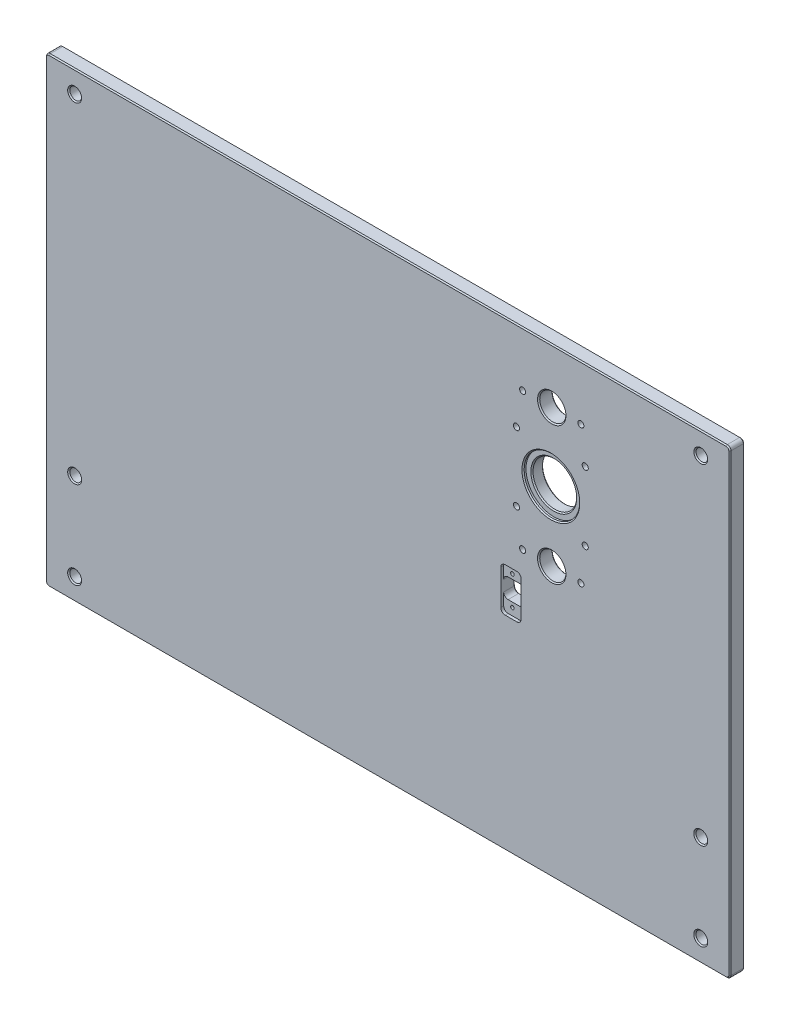
from build123d import *

# Parameters (mm, degrees)
SKETCH2_W             = 470
SKETCH2_H             = 317
BOSS_EXTRUDE1_DEPTH   = 5
SKETCH3_R             = 4.05
CUT_EXTRUDE1_DEPTH    = 10
SKETCH4_R             = 9
CUT_EXTRUDE2_DEPTH    = 284.632244288
M5X0_8_TAPPED_HOLE1_D = 4.2
SKETCH7_R             = 19.1
CUT_EXTRUDE5_DEPTH    = 2
M5X0_8_TAPPED_HOLE2_D = 4.2
SKETCH10_R            = 4
CUT_EXTRUDE8_DEPTH    = 284.632244288
SKETCH19_R            = 15
CUT_EXTRUDE10_DEPTH   = 284.568774727
SKETCH20_W            = 14
SKETCH20_H            = 30
CUT_EXTRUDE11_DEPTH   = 2
M3X0_5_TAPPED_HOLE2_D = 2.5
SKETCH23_W            = 14
SKETCH23_H            = 13.5
CUT_EXTRUDE13_DEPTH   = 284.568774727
FILLET1_R             = 3
FILLET2_R             = 2.5
CHAMFER1_SIZE         = 0.75


with BuildPart() as part:
    # Sketch2 → Boss-Extrude1 (new, symmetric)
    with BuildSketch(Plane.XY):
        Rectangle(SKETCH2_W, SKETCH2_H)
    extrude(amount=BOSS_EXTRUDE1_DEPTH, both=True)

    # Sketch3 → Cut-Extrude1 (cut)
    with BuildSketch(Plane.XY.offset(5)):
        with Locations((-215, -83.5)):
            Circle(SKETCH3_R)
        with Locations((-215, -143.5)):
            Circle(SKETCH3_R)
        with Locations((215, -83.5)):
            Circle(SKETCH3_R)
        with Locations((215, -143.5)):
            Circle(SKETCH3_R)
        with Locations((-215, 143.5)):
            Circle(SKETCH3_R)
    extrude(amount=-CUT_EXTRUDE1_DEPTH, mode=Mode.SUBTRACT)

    # Sketch4 → Cut-Extrude2 (cut, through all)
    with BuildSketch(Plane.XY.offset(5)):
        with Locations((112.65, 121)):
            Circle(SKETCH4_R)
        with Locations((112.65, 26.5)):
            Circle(SKETCH4_R)
    extrude(amount=-CUT_EXTRUDE2_DEPTH, mode=Mode.SUBTRACT)

    # M5x0.8 Tapped Hole1 (through all)
    with Locations(Plane.XY.offset(5)):
        with Locations((132.65, 121), (92.65, 121), (92.65, 26.5), (132.65, 26.5)):
            Hole(M5X0_8_TAPPED_HOLE1_D / 2)

    # Sketch7 → Cut-Extrude5 (cut)
    with BuildSketch(Plane.XY.offset(5)):
        with Locations((112.05, 73.75)):
            Circle(SKETCH7_R)
    extrude(amount=-CUT_EXTRUDE5_DEPTH, mode=Mode.SUBTRACT)

    # M5x0.8 Tapped Hole2 (through all)
    with Locations(Plane.XY.offset(5)):
        with Locations((88.45, 97.35), (135.65, 97.35), (135.65, 50.15), (88.45, 50.15)):
            Hole(M5X0_8_TAPPED_HOLE2_D / 2)

    # Sketch10 → Cut-Extrude8 (cut, through all)
    with BuildSketch(Plane.XY.offset(5)):
        with Locations((215, 143.5)):
            Circle(SKETCH10_R)
    extrude(amount=-CUT_EXTRUDE8_DEPTH, mode=Mode.SUBTRACT)

    # Sketch19 → Cut-Extrude10 (cut, through all)
    with BuildSketch(Plane.XY.offset(3)):
        with Locations((112.05, 73.75)):
            Circle(SKETCH19_R)
    extrude(amount=-CUT_EXTRUDE10_DEPTH, mode=Mode.SUBTRACT)

    # Sketch20 → Cut-Extrude11 (cut)
    with BuildSketch(Plane.XY.offset(5)):
        with Locations((84.65, -3.5)):
            Rectangle(SKETCH20_W, SKETCH20_H)
    extrude(amount=-CUT_EXTRUDE11_DEPTH, mode=Mode.SUBTRACT)

    # M3x0.5 Tapped Hole2 (through all)
    with Locations(Plane.XY.offset(3)):
        with Locations((83.65, 6.5), (83.65, -13.5)):
            Hole(M3X0_5_TAPPED_HOLE2_D / 2)

    # Sketch23 → Cut-Extrude13 (cut, through all)
    with BuildSketch(Plane.XY.offset(3)):
        with Locations((84.65, -3.5)):
            Rectangle(SKETCH23_W, SKETCH23_H)
    extrude(amount=-CUT_EXTRUDE13_DEPTH, mode=Mode.SUBTRACT)

    # Fillet1
    fillet1_edges = [part.edges().sort_by_distance(p)[0] for p in [
        (91.65, -18.5, 4),
        (77.65, -18.5, 4),
        (77.65, 11.5, 4),
        (91.65, 11.5, 4),
        (77.65, -10.25, -1),
        (77.65, 3.25, -1),
        (91.65, 3.25, -1),
        (91.65, -10.25, -1),
    ]]
    fillet(fillet1_edges, radius=FILLET1_R)

    # Fillet2
    fillet2_edges = [part.edges().sort_by_distance(p)[0] for p in [
        (-235, -158.5, 0),
        (235, -158.5, 0),
        (235, 158.5, 0),
        (-235, 158.5, 0),
    ]]
    fillet(fillet2_edges, radius=FILLET2_R)

    # Chamfer1
    chamfer1_edges = [part.edges().sort_by_distance(p)[0] for p in [
        (-219.05, -143.5, -5),
        (-219.05, -83.5, -5),
        (-219.05, 143.5, -5),
        (78.528679656, -9.371320344, -5),
        (77.65, -3.5, -5),
        (78.528679656, 2.371320344, -5),
        (84.65, 3.25, -5),
        (90.771320344, 2.371320344, -5),
        (91.65, -3.5, -5),
        (90.771320344, -9.371320344, -5),
        (84.65, -10.25, -5),
        (103.65, 121, -5),
        (97.05, 73.75, -5),
        (103.65, 26.5, -5),
        (210.95, -143.5, -5),
        (210.95, -83.5, -5),
        (211, 143.5, -5),
        (97.05, 73.75, 3),
        (210.95, -143.5, 5),
        (210.95, -83.5, 5),
        (211, 143.5, 5),
        (103.65, 26.5, 5),
        (92.95, 73.75, 5),
        (103.65, 121, 5),
        (-219.05, 143.5, 5),
        (-219.05, -83.5, 5),
        (-219.05, -143.5, 5),
        (-234.267766953, -157.767766953, 5),
        (0, -158.5, 5),
        (234.267766953, -157.767766953, 5),
        (235, 0, 5),
        (234.267766953, 157.767766953, 5),
        (0, 158.5, 5),
        (-234.267766953, 157.767766953, 5),
        (-235, 0, 5),
        (-234.267766953, 157.767766953, -5),
        (-235, 0, -5),
        (-234.267766953, -157.767766953, -5),
        (0, 158.5, -5),
        (234.267766953, 157.767766953, -5),
        (235, 0, -5),
        (234.267766953, -157.767766953, -5),
        (0, -158.5, -5),
    ]]
    chamfer(chamfer1_edges, length=CHAMFER1_SIZE)


solid = part.part
